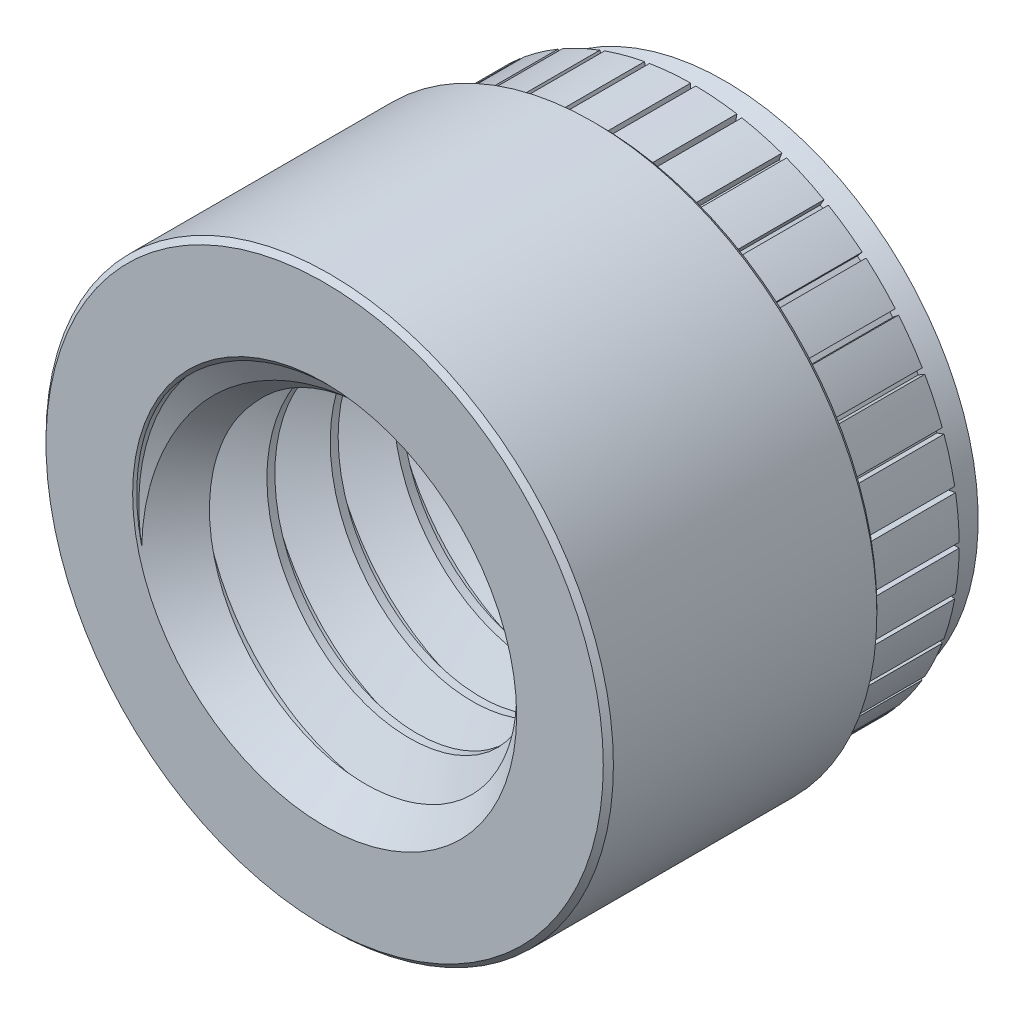
from build123d import *

# Parameters (mm, degrees)
SKETCH1_R               = 7.112
EXTRUDE1_DEPTH          = 6.858
SKETCH2_R               = 6.6675
EXTRUDE2_DEPTH          = 3.175
SKETCH3_W               = 0.127
SKETCH3_H               = 0.635
CUT_EXTRUDE_THIN1_DEPTH = 3.175
CIRPATTERN1_COUNT       = 36
SKETCH5_OUTSIDE_W       = 21.298
SKETCH5_OUTSIDE_H       = 21.298
SKETCH5_OUTSIDE_R       = 6.35
CUT_EXTRUDE1_DEPTH      = 0.79375
CUT_EXTRUDE1_DRAFT      = 20
CHAMFER2_SIZE           = 0.127
SKETCH7_R               = 4.7625
CUT_EXTRUDE3_DEPTH      = 15.206413235
SWEEP1_PITCH            = 1.5875
SKETCH10_R              = 7.112
CUT_EXTRUDE4_DEPTH      = 16.219348172
SKETCH11_R              = 6.35
CUT_EXTRUDE5_DEPTH      = 15.206413305


with BuildPart() as part:
    # Sketch1 → Extrude1 (new body)
    with BuildSketch(Plane.XY):
        Circle(SKETCH1_R)
    extrude(amount=-EXTRUDE1_DEPTH)

    # Sketch2 → Extrude2 (add)
    with BuildSketch(Plane(origin=(0, 0, -6.858), x_dir=(-1, 0, 0), z_dir=(0, 0, -1))):
        with Locations(Location((0, 0, 0), (0, 0, 180))):
            Circle(SKETCH2_R)
    extrude(amount=EXTRUDE2_DEPTH)

    # Sketch3 → Cut-Extrude-Thin1 (cut)
    with BuildSketch(Plane(origin=(0, 0, -10.033), x_dir=(-1, 0, 0), z_dir=(0, 0, -1))):
        with Locations((0, 6.7945)):
            Rectangle(SKETCH3_W, SKETCH3_H)
    cut_extrude_thin1 = extrude(amount=-CUT_EXTRUDE_THIN1_DEPTH, mode=Mode.SUBTRACT)

    # CirPattern1: Cut-Extrude-Thin1 ×36 about axis
    cirpattern1_axis = Axis((0, 0, 0), (0, 0, 1))
    for i in range(1, CIRPATTERN1_COUNT):
        add(cut_extrude_thin1.rotate(cirpattern1_axis, i * 360 / CIRPATTERN1_COUNT), mode=Mode.SUBTRACT)


with BuildPart() as cut_extrude1_tool:
    # Sketch5 outside → Cut-Extrude1 (with draft: the straight prism first)
    with BuildSketch(Plane(origin=(0, 0, -10.033), x_dir=(-1, 0, 0), z_dir=(0, 0, -1))):
        Rectangle(SKETCH5_OUTSIDE_W, SKETCH5_OUTSIDE_H)
        Circle(SKETCH5_OUTSIDE_R, mode=Mode.SUBTRACT)
    extrude(amount=-CUT_EXTRUDE1_DEPTH)
    # Cut-Extrude1: the draft: its side faces are tilted about the plane it starts from
    cut_extrude1_sides = [cut_extrude1_tool.faces().sort_by_distance(p)[0] for p in [
        (0, -10.649, -9.636125),
        (-10.649, 0, -9.636125),
        (0, 10.649, -9.636125),
        (10.649, 0, -9.636125),
        (6.35, 0, -9.636125),
    ]]
    draft(cut_extrude1_sides, Plane(origin=(0, 0, -10.033), x_dir=(-1, 0, 0), z_dir=(0, 0, -1)), CUT_EXTRUDE1_DRAFT)


with BuildPart() as part_1:
    add(part.part)

    # Cut-Extrude1: cut by cut_extrude1_tool
    add(cut_extrude1_tool.part, mode=Mode.SUBTRACT)

    # Chamfer2
    chamfer2_edges = [part_1.edges().sort_by_distance(p)[0] for p in [
        (-7.112, 0, 0),
        (-7.112, 0, -6.858),
    ]]
    chamfer(chamfer2_edges, length=CHAMFER2_SIZE)

    # Sketch7 → Cut-Extrude3 (cut, through all)
    with BuildSketch(Plane.XY):
        Circle(SKETCH7_R)
    extrude(amount=-CUT_EXTRUDE3_DEPTH, mode=Mode.SUBTRACT)

    # Sweep1: the profile of Sketch9 profile screwed along a right-hand helix of 8.32 turns, 6 arcs to a turn; built about Z, then put on its axis
    sweep1_z = Axis((0, 0, 0), (0, 0, 1))
    sweep1_corners = [(4.7628, 0, -1.389235705), (3.731388504, 0, -0.79375), (3.731388504, 0, -0.5953125), (4.7628, 0, 0.000173205)]
    with BuildLine(mode=Mode.PRIVATE) as sweep1_profile:
        Line(sweep1_corners[0], sweep1_corners[1])
        Line(sweep1_corners[1], sweep1_corners[2])
        Line(sweep1_corners[2], sweep1_corners[3])
        Line(sweep1_corners[3], sweep1_corners[0])
    sweep1_cap = Face(sweep1_profile.wire())
    sweep1_turn_angles = [0, 30, 60, 90, 120, 150, 180, 210, 240, 270, 300, 330, 360]
    sweep1_turn_weights = [1, 0.8660254037844387, 1, 0.8660254037844387, 1, 0.8660254037844387, 1, 0.8660254037844387, 1, 0.8660254037844387, 1, 0.8660254037844387, 1]
    sweep1_turn_rails = [Edge.make_bspline([Vector(p[0], p[1], 0).rotate(sweep1_z, sweep1_turn_angles[k]) / sweep1_turn_weights[k] + Vector(0, 0, p[2] + SWEEP1_PITCH * sweep1_turn_angles[k] / 360) for k in range(13)], [0, 0, 0, 1, 1, 2, 2, 3, 3, 4, 4, 5, 5, 6, 6, 6], 2, sweep1_turn_weights) for p in sweep1_corners]
    sweep1_turn_sides = [Face.make_surface_from_curves(sweep1_turn_rails[p[0]], sweep1_turn_rails[p[1]]) for p in [(0, 1), (1, 2), (2, 3), (3, 0)]]
    sweep1_last_angles = [2880, 2910, 2940, 2967.6, 2995.2]
    sweep1_last_weights = [1, 0.8660254037844387, 1, 0.8862035792312155, 1]
    sweep1_last_rails = [Edge.make_bspline([Vector(p[0], p[1], 0).rotate(sweep1_z, sweep1_last_angles[k]) / sweep1_last_weights[k] + Vector(0, 0, p[2] + SWEEP1_PITCH * sweep1_last_angles[k] / 360) for k in range(5)], [0, 0, 0, 1, 1, 2, 2, 2], 2, sweep1_last_weights) for p in sweep1_corners]
    sweep1_last_sides = [Face.make_surface_from_curves(sweep1_last_rails[p[0]], sweep1_last_rails[p[1]]) for p in [(0, 1), (1, 2), (2, 3), (3, 0)]]
    sweep1 = Plane(origin=(0, 0, -10.033), x_dir=(0, 1, 0), z_dir=(0, 0, 1)) * Solid(Shell([*[p.moved(Location((0, 0, SWEEP1_PITCH * i))) for i in range(8) for p in sweep1_turn_sides], *sweep1_last_sides, sweep1_cap, sweep1_cap.rotate(sweep1_z, 2995.2).moved(Location((0, 0, SWEEP1_PITCH * 2995.2 / 360)))]))
    add(sweep1)

    # Sketch10 → Cut-Extrude4 (cut, through all)
    with BuildSketch(Plane.XY):
        Circle(SKETCH10_R)
    extrude(amount=CUT_EXTRUDE4_DEPTH, mode=Mode.SUBTRACT)

    # Sketch11 → Cut-Extrude5 (cut, through all)
    with BuildSketch(Plane(origin=(0, 0, -10.033), x_dir=(-1, 0, 0), z_dir=(0, 0, -1))):
        Circle(SKETCH11_R)
    extrude(amount=CUT_EXTRUDE5_DEPTH, mode=Mode.SUBTRACT)

    # Cut-Extrude6 cone 1 section (through the dimple's axis) → Cut-Extrude6 (revolve, cut)
    with BuildSketch(Plane(origin=(0, 0, 0), x_dir=(0, -1, 0), z_dir=(1, 0, 0))):
        Polygon((0, 0), (4.8133, 0), (0, 4.8133), align=None)
    revolve(axis=Axis((0, 0, 0), (0, 0, -1)), mode=Mode.SUBTRACT)

    # Cut-Extrude7 cone 1 section (through the dimple's axis) → Cut-Extrude7 (revolve, cut)
    with BuildSketch(Plane(origin=(0, 0, -10.033), x_dir=(0, 1, 0), z_dir=(1, 0, 0))):
        Polygon((0, 0), (4.8133, 0), (0, 4.8133), align=None)
    revolve(axis=Axis((0, 0, -10.033), (0, 0, 1)), mode=Mode.SUBTRACT)


solid = part_1.part
